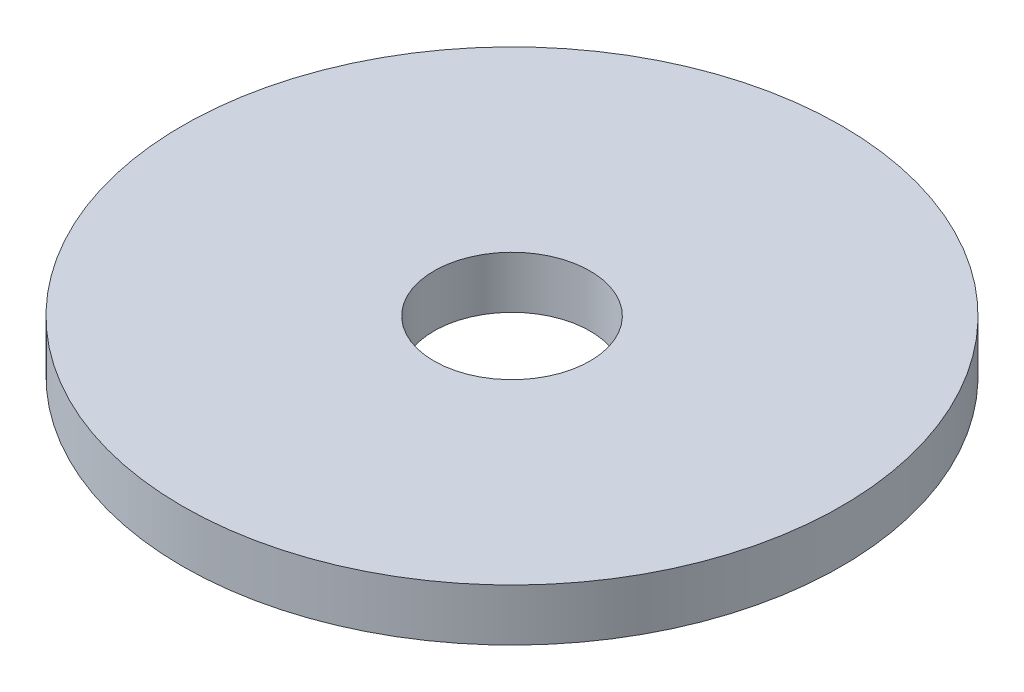
from build123d import *

# Parameters (mm, degrees)
SKETCH1_R           = 95
BOSS_EXTRUDE1_DEPTH = 15
SKETCH2_R           = 22.5
CUT_EXTRUDE1_DEPTH  = 136.185058346


with BuildPart() as part:
    # Sketch1 → Boss-Extrude1 (new body)
    with BuildSketch(Plane(origin=(0, 0, 0), x_dir=(1, 0, 0), z_dir=(0, 1, 0))):
        Circle(SKETCH1_R)
    extrude(amount=BOSS_EXTRUDE1_DEPTH)

    # Sketch2 → Cut-Extrude1 (cut, through all)
    with BuildSketch(Plane(origin=(0, 0, 0), x_dir=(1, 0, 0), z_dir=(0, 1, 0))):
        Circle(SKETCH2_R)
    extrude(amount=CUT_EXTRUDE1_DEPTH, mode=Mode.SUBTRACT)


solid = part.part
